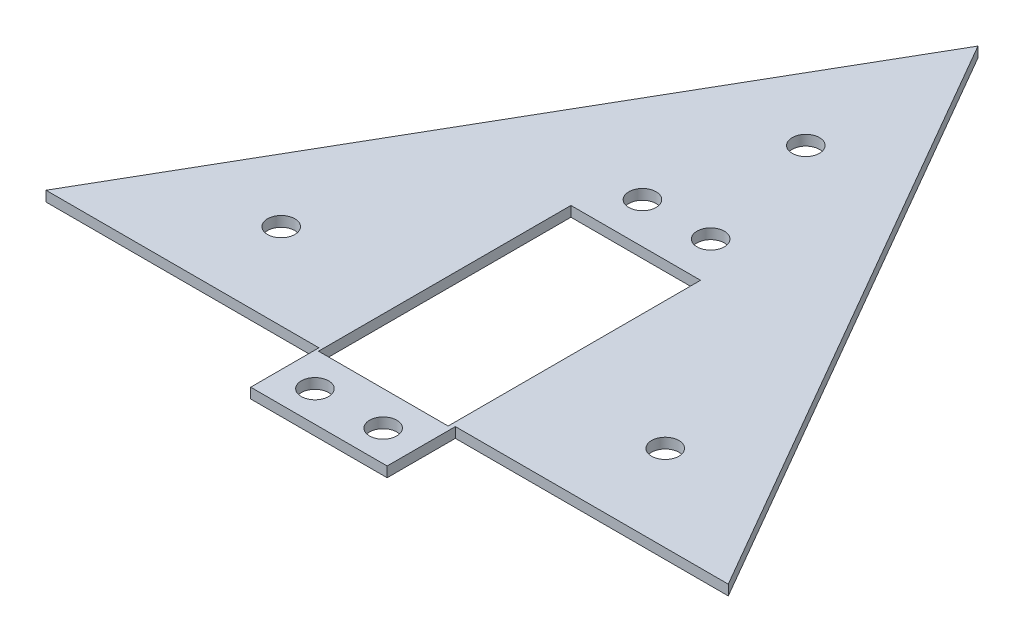
from build123d import *

# Parameters (mm, degrees)
BASE_FLANGE1_DEPTH = 1.5
SKETCH6_R          = 2
CUT_EXTRUDE1_DEPTH = 10
SKETCH7_R          = 2
SKETCH7_W          = 19
SKETCH7_H          = 37
CUT_EXTRUDE2_DEPTH = 10


# Sheet-metal steps are written as plain solids
with BuildPart() as part:
    # Sketch1 → Base-Flange1 (new body)
    with BuildSketch(Plane(origin=(0, 0, 0), x_dir=(1, 0, 0), z_dir=(0, 1, 0))):
        Polygon((0, 57.735026919), (-50, -28.867513459), (-10, -28.867513459), (-10, -38.867513459), (10, -38.867513459), (10, -28.867513459), (50, -28.867513459), align=None)
    extrude(amount=-BASE_FLANGE1_DEPTH)

    # Sketch6 → Cut-Extrude1 (cut)
    with BuildSketch(Plane(origin=(0, 0, 0), x_dir=(1, 0, 0), z_dir=(0, 1, 0))):
        with Locations(Location((0, 32.5, 0), (0, 0, 270))):
            Circle(SKETCH6_R)
        with Locations(Location((28.145825623, -16.25, 0), (0, 0, 270))):
            Circle(SKETCH6_R)
        with Locations(Location((-28.145825623, -16.25, 0), (0, 0, 270))):
            Circle(SKETCH6_R)
    extrude(amount=-CUT_EXTRUDE1_DEPTH, mode=Mode.SUBTRACT)

    # Sketch7 → Cut-Extrude2 (cut)
    with BuildSketch(Plane(origin=(0, 0, 0), x_dir=(1, 0, 0), z_dir=(0, 1, 0))):
        with Locations(Location((-5.1, -34.347513459, 0), (0, 0, 270))):
            Circle(SKETCH7_R)
        with Locations(Location((4.9, -34.347513459, 0), (0, 0, 270))):
            Circle(SKETCH7_R)
        with Locations(Location((-5.1, 13.652486541, 0), (0, 0, 270))):
            Circle(SKETCH7_R)
        with Locations(Location((4.9, 13.652486541, 0), (0, 0, 270))):
            Circle(SKETCH7_R)
        with Locations((-0.1, -10.827513459)):
            Rectangle(SKETCH7_W, SKETCH7_H)
    extrude(amount=-CUT_EXTRUDE2_DEPTH, mode=Mode.SUBTRACT)


solid = part.part
